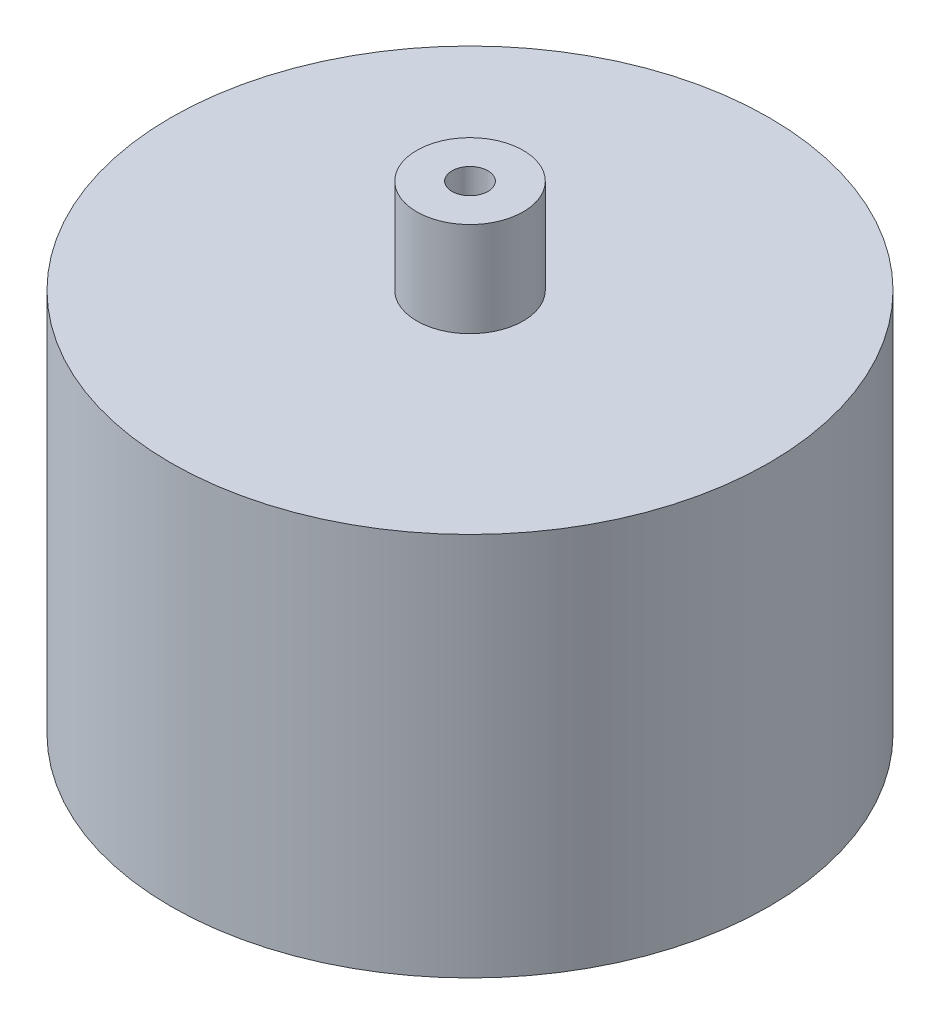
from build123d import *

# Parameters (mm, degrees)
SKETCH1_R           = 25
BOSS_EXTRUDE1_DEPTH = 40
CUT_EXTRUDE1_START  = -7.9
SKETCH2_R           = 25
SKETCH2_R_2         = 4.45
CUT_EXTRUDE1_DEPTH  = 7.9
SKETCH3_R           = 1.5
CUT_EXTRUDE2_DEPTH  = 54.38539126


with BuildPart() as part:
    # Sketch1 → Boss-Extrude1 (new body)
    with BuildSketch(Plane(origin=(0, 0, 0), x_dir=(1, 0, 0), z_dir=(0, 1, 0))):
        Circle(SKETCH1_R)
    extrude(amount=BOSS_EXTRUDE1_DEPTH)

    # Sketch2 → Cut-Extrude1 (cut)
    with BuildSketch(Plane(origin=(0, 40, 0), x_dir=(1, 0, 0), z_dir=(0, 1, 0)).offset(CUT_EXTRUDE1_START)):
        Circle(SKETCH2_R)
        Circle(SKETCH2_R_2, mode=Mode.SUBTRACT)
    extrude(amount=CUT_EXTRUDE1_DEPTH, mode=Mode.SUBTRACT)

    # Sketch3 → Cut-Extrude2 (cut, through all)
    with BuildSketch(Plane(origin=(0, 40, 0), x_dir=(1, 0, 0), z_dir=(0, 1, 0))):
        Circle(SKETCH3_R)
    extrude(amount=-CUT_EXTRUDE2_DEPTH, mode=Mode.SUBTRACT)


solid = part.part
